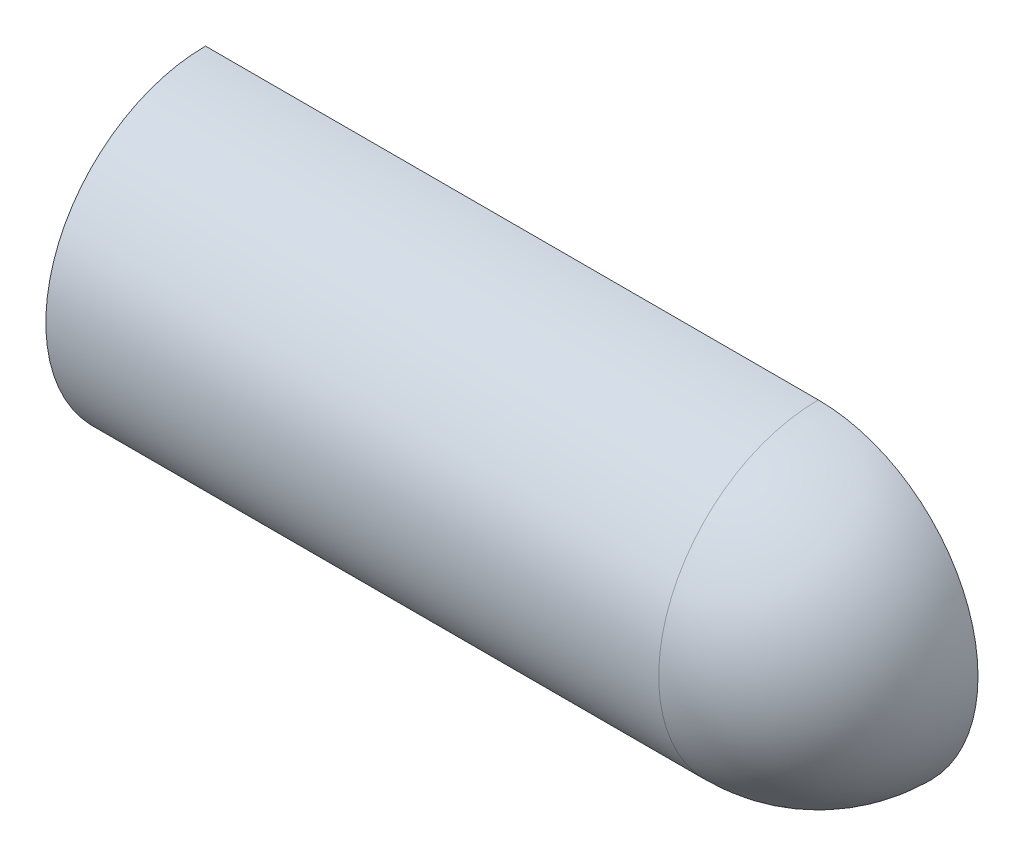
from build123d import *

# Parameters (mm, degrees)
REVOLVE1_ANGLE = 180


with BuildPart() as part:
    # Sketch2 → Revolve1 (revolve)
    with BuildSketch(Plane.XY):
        with BuildLine():
            Line((25.999999996, 0), (31.000000005, 0))
            ThreePointArc((31.000000005, 0), (21.920310223, 21.920310224), (0, 31))
            Line((0, 31), (-119, 31))
            Line((-119, 31), (-119, 26))
            Line((-119, 26), (5e-09, 26))
            ThreePointArc((5e-09, 26), (18.384776312, 18.38477631), (25.999999996, 0))
        make_face()
    revolve(axis=Axis((25.999999996, 0, 0), (1, 0, 0)), revolution_arc=REVOLVE1_ANGLE)


solid = part.part
